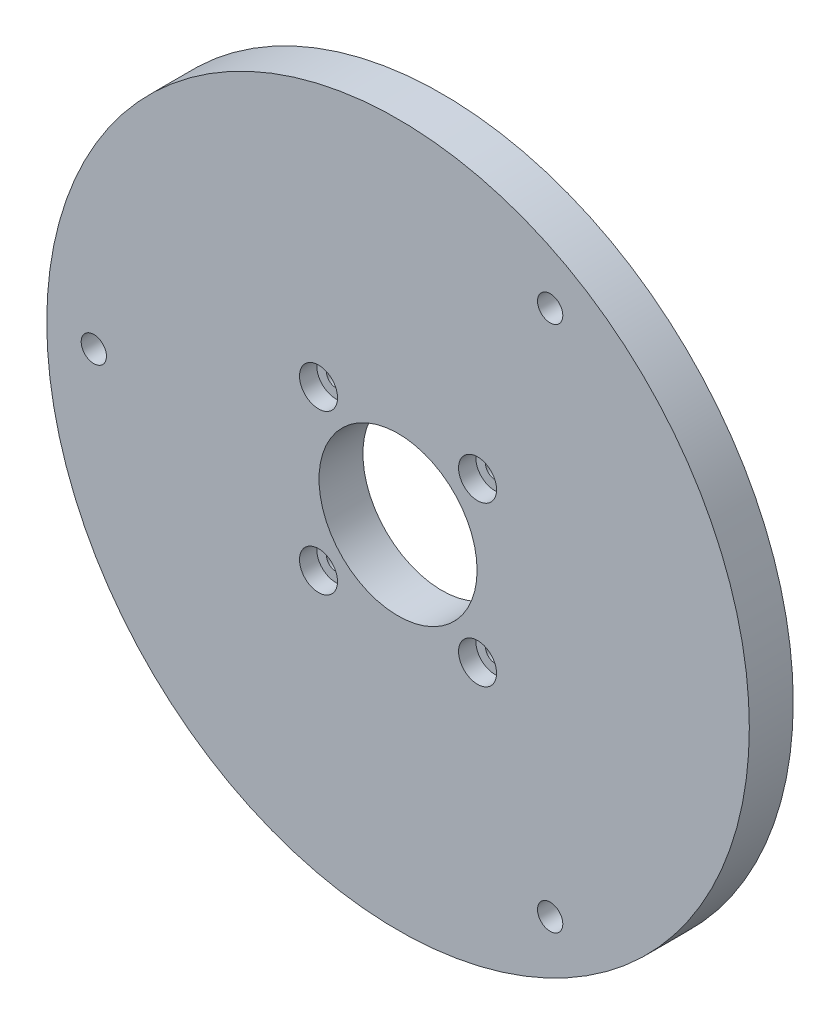
from build123d import *

# Parameters (mm, degrees)
SKETCH1_R                        = 50.8
BOSS_EXTRUDE1_DEPTH              = 6.35
SKETCH2_R                        = 11.43
CUT_EXTRUDE1_DEPTH               = 73.122135992
CBORE_FOR_M2_5_SHCS1_D           = 2.7
CBORE_FOR_M2_5_SHCS1_DEPTH       = 10.16
CBORE_FOR_M2_5_SHCS1_CBORE_D     = 5.5
CBORE_FOR_M2_5_SHCS1_CBORE_DEPTH = 2.5
CBORE_FOR_M2_5_SHCS1_TIP         = 0.811161836
F_6_CLEARANCE_HOLE1_D            = 3.6576
F_6_CLEARANCE_HOLE1_DEPTH        = 10.16
F_6_CLEARANCE_HOLE1_TIP          = 1.0988539


with BuildPart() as part:
    # Sketch1 → Boss-Extrude1 (new body)
    with BuildSketch(Plane.XY):
        Circle(SKETCH1_R)
    extrude(amount=BOSS_EXTRUDE1_DEPTH)

    # Sketch2 → Cut-Extrude1 (cut, through all)
    with BuildSketch(Plane.XY.offset(6.35)):
        Circle(SKETCH2_R)
    extrude(amount=-CUT_EXTRUDE1_DEPTH, mode=Mode.SUBTRACT)

    # CBORE for M2.5 SHCS1
    with Locations(Plane.XY.offset(6.35)):
        with Locations((0, 0), (11.5, 11.5), (-11.5, -11.5), (-11.5, 11.5), (11.5, -11.5)):
            CounterBoreHole(CBORE_FOR_M2_5_SHCS1_D / 2, CBORE_FOR_M2_5_SHCS1_CBORE_D / 2, CBORE_FOR_M2_5_SHCS1_CBORE_DEPTH, depth=CBORE_FOR_M2_5_SHCS1_DEPTH)
            with Locations((0, 0, -(CBORE_FOR_M2_5_SHCS1_DEPTH + CBORE_FOR_M2_5_SHCS1_TIP / 2))):  # 118° drill point
                Cone(0, CBORE_FOR_M2_5_SHCS1_D / 2, CBORE_FOR_M2_5_SHCS1_TIP, mode=Mode.SUBTRACT)

    # #6 Clearance Hole1
    with Locations(Plane.XY.offset(6.35)):
        with Locations((-43.994090512, 0), (21.997045256, -38.1), (21.997045256, 38.1)):
            Hole(F_6_CLEARANCE_HOLE1_D / 2, depth=F_6_CLEARANCE_HOLE1_DEPTH)
            with Locations((0, 0, -(F_6_CLEARANCE_HOLE1_DEPTH + F_6_CLEARANCE_HOLE1_TIP / 2))):  # 118° drill point
                Cone(0, F_6_CLEARANCE_HOLE1_D / 2, F_6_CLEARANCE_HOLE1_TIP, mode=Mode.SUBTRACT)


solid = part.part
